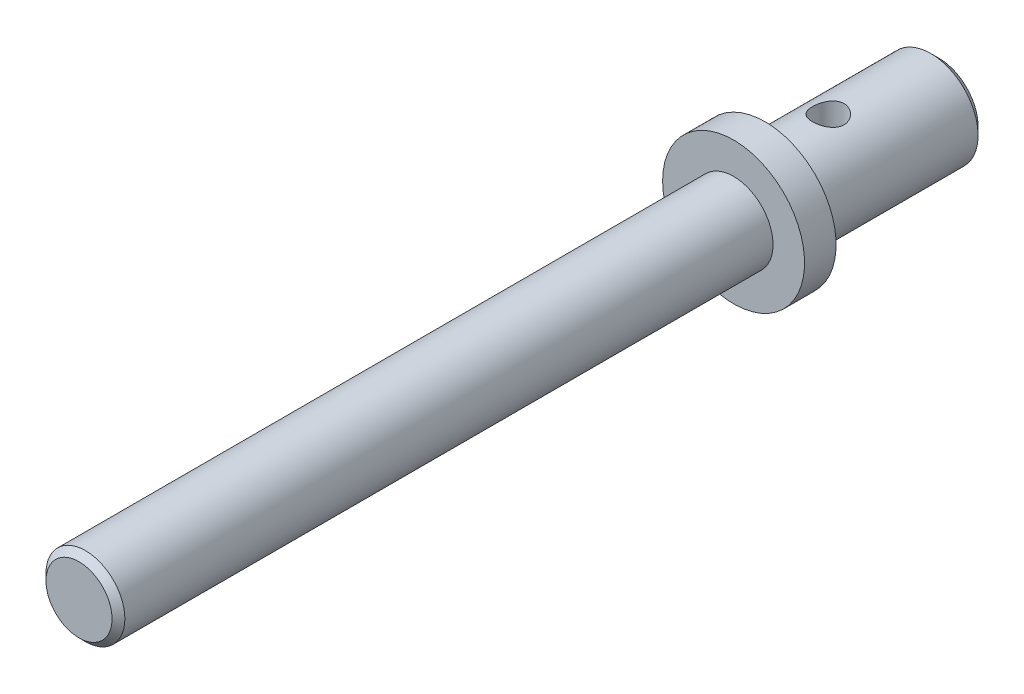
from build123d import *

# Parameters (mm, degrees)
SKETCH_1_R               = 5
EXTRUDE_1_DEPTH          = 83
SKETCH_3_R               = 9
EXTRUDE_2_DEPTH          = 4
SKETCH_4_R               = 6
EXTRUDE_3_DEPTH          = 22
CUT_EXTRUDE_1_DEPTH      = 110.740603242
CUT_EXTRUDE_1_DEPTH_BACK = 110.740603242
SKETCH_5_R               = 2
CHAMFER_1_SIZE           = 1


# Read off the part's stored shape, not the designer's step: M10 机械螺纹 螺柱1
with BuildPart() as part:
    # 草图1 → 凸台-拉伸1 (new body)
    with BuildSketch(Plane.XY):
        Circle(SKETCH_1_R)
    extrude(amount=-EXTRUDE_1_DEPTH)

    # M10 机械螺纹 螺柱1 outline → M10 机械螺纹 螺柱1 (revolve, cut)
    with BuildSketch(Plane.XZ):
        Polygon((5, 0), (4.188, 0), (5, -0.812), align=None)
    revolve(axis=Axis((0, 0, 0), (0, 0, 1)), mode=Mode.SUBTRACT)

    # 草图3 → 凸台-拉伸2 (add)
    with BuildSketch(Plane(origin=(0, 0, -83), x_dir=(-1, 0, 0), z_dir=(0, 0, -1))):
        Circle(SKETCH_3_R)
    extrude(amount=EXTRUDE_2_DEPTH)

    # 草图4 → 凸台-拉伸3 (add)
    with BuildSketch(Plane(origin=(0, 0, -87), x_dir=(-1, 0, 0), z_dir=(0, 0, -1))):
        Circle(SKETCH_4_R)
    extrude(amount=EXTRUDE_3_DEPTH)

    # 草图5 → 切除-拉伸1 (cut, two sides: drawn at the far end of the back side and taken through both)
    with BuildSketch(Plane(origin=(0, 0, 0), x_dir=(1, 0, 0), z_dir=(0, 1, 0)).offset(-CUT_EXTRUDE_1_DEPTH_BACK)):
        with Locations(Location((0, 95, 0), (0, 0, 270))):
            Circle(SKETCH_5_R)
    extrude(amount=CUT_EXTRUDE_1_DEPTH + CUT_EXTRUDE_1_DEPTH_BACK, mode=Mode.SUBTRACT)

    # 倒角1
    chamfer_1_edges = [part.edges().sort_by_distance(p)[0] for p in [
        (6, 0, -109),
    ]]
    chamfer(chamfer_1_edges, length=CHAMFER_1_SIZE)


solid = part.part
